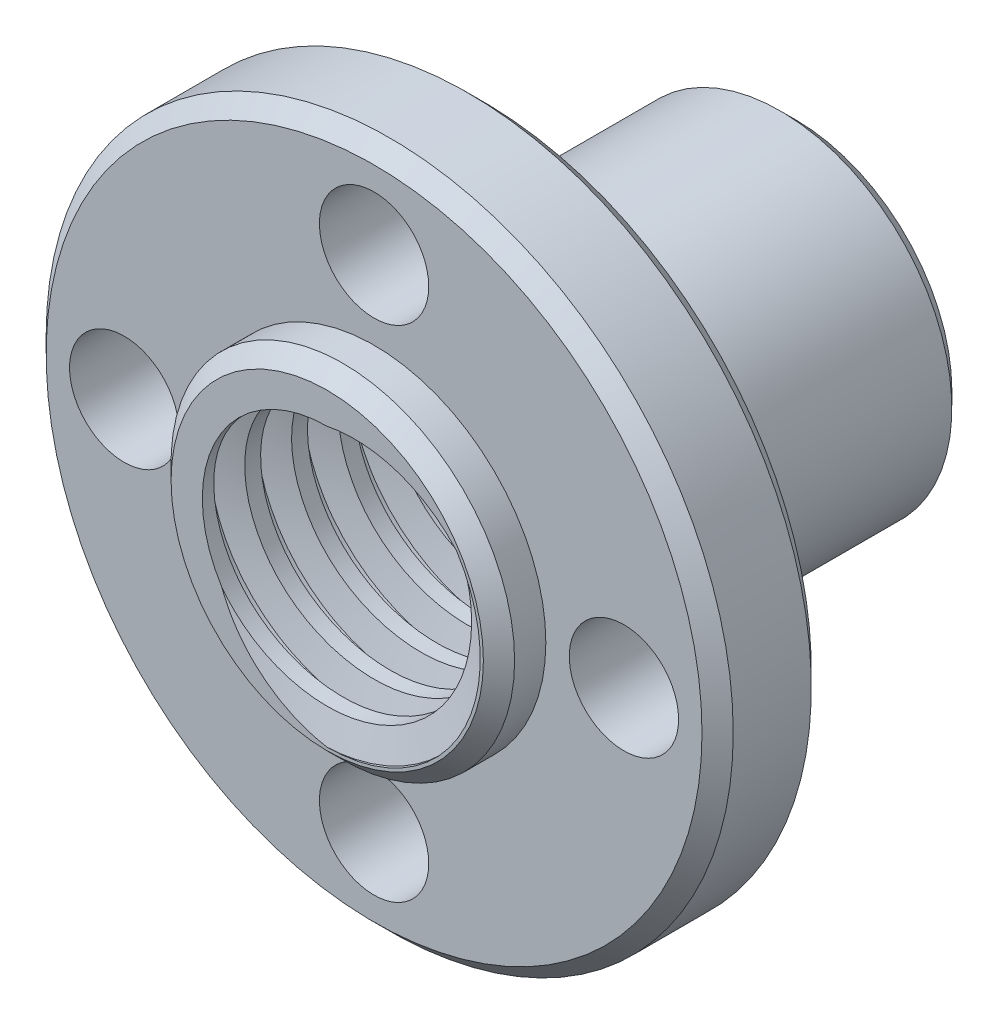
from build123d import *

# Parameters (mm, degrees)
SKETCH_1_W          = 15
SKETCH_1_H          = 7
SWEEP_1_PITCH       = 1.5
CUT_EXTRUDE_START   = -1.5
SKETCH_4_R          = 11
SKETCH_4_R_2        = 5.5
CUT_EXTRUDE_1_DEPTH = 1.5
SKETCH_5_R          = 11
SKETCH_5_R_2        = 5.5
CUT_EXTRUDE_2_DEPTH = 10
SKETCH_6_R          = 1.75
CUT_EXTRUDE_3_DEPTH = 21.59732999
CHAMFER_1_SIZE      = 0.5


with BuildPart() as part:
    # 草图1 → 旋转1 (revolve)
    with BuildSketch(Plane(origin=(0, 0, 0), x_dir=(0, 0, -1), z_dir=(1, 0, 0)), mode=Mode.PRIVATE) as revolve_1_sk:
        with Locations((-7.5, 7.5)):
            Rectangle(SKETCH_1_W, SKETCH_1_H)
    revolve(revolve_1_sk.sketch.rotate(Axis((0, 0, 0), (0, 0, 1)), 90), axis=Axis((0, 0, 0), (0, 0, 1)))

    # 切除-扫描1: the profile of 草图2 profile screwed along a left-hand helix of 20 turns, 6 arcs to a turn; built about Z, then put on its axis
    sweep_1_z = Axis((0, 0, 0), (0, 0, 1))
    sweep_1_corners = [(3.9997, 0, 8.0385e-05), (3.9997, 0, -0.991234658), (4.9, 0, -0.75), (4.9, 0, -0.241154273)]
    with BuildLine(mode=Mode.PRIVATE) as sweep_1_profile:
        Line(sweep_1_corners[0], sweep_1_corners[1])
        Line(sweep_1_corners[1], sweep_1_corners[2])
        Line(sweep_1_corners[2], sweep_1_corners[3])
        Line(sweep_1_corners[3], sweep_1_corners[0])
    sweep_1_cap = Face(sweep_1_profile.wire())
    sweep_1_turn_angles = [0, -30, -60, -90, -120, -150, -180, -210, -240, -270, -300, -330, -360]
    sweep_1_turn_weights = [1, 0.8660254037844387, 1, 0.8660254037844387, 1, 0.8660254037844387, 1, 0.8660254037844387, 1, 0.8660254037844387, 1, 0.8660254037844387, 1]
    sweep_1_turn_rails = [Edge.make_bspline([Vector(p[0], p[1], 0).rotate(sweep_1_z, sweep_1_turn_angles[k]) / sweep_1_turn_weights[k] + Vector(0, 0, p[2] + -SWEEP_1_PITCH * sweep_1_turn_angles[k] / 360) for k in range(13)], [0, 0, 0, 1, 1, 2, 2, 3, 3, 4, 4, 5, 5, 6, 6, 6], 2, sweep_1_turn_weights) for p in sweep_1_corners]
    sweep_1_turn_sides = [Face.make_surface_from_curves(sweep_1_turn_rails[p[0]], sweep_1_turn_rails[p[1]]) for p in [(0, 1), (1, 2), (2, 3), (3, 0)]]
    sweep_1 = Plane(origin=(0, 0, 0), x_dir=(0, 1, 0), z_dir=(0, 0, 1)) * Solid(Shell([*[p.moved(Location((0, 0, SWEEP_1_PITCH * i))) for i in range(20) for p in sweep_1_turn_sides], sweep_1_cap, sweep_1_cap.rotate(sweep_1_z, -7200).moved(Location((0, 0, -SWEEP_1_PITCH * -7200 / 360)))]))
    add(sweep_1, mode=Mode.SUBTRACT)

    # 草图4 → 切除-拉伸1 (cut)
    with BuildSketch(Plane.XY.offset(15).offset(CUT_EXTRUDE_START)):
        with Locations(Location((0, 0, 0), (0, 0, 180))):
            Circle(SKETCH_4_R)
        Circle(SKETCH_4_R_2, mode=Mode.SUBTRACT)
    extrude(amount=CUT_EXTRUDE_1_DEPTH, mode=Mode.SUBTRACT)

    # 草图5 → 切除-拉伸2 (cut)
    with BuildSketch(Plane(origin=(0, 0, 0), x_dir=(-1, 0, 0), z_dir=(0, 0, -1))):
        Circle(SKETCH_5_R)
        with Locations(Location((0, 0, 0), (0, 0, 180))):
            Circle(SKETCH_5_R_2, mode=Mode.SUBTRACT)
    extrude(amount=-CUT_EXTRUDE_2_DEPTH, mode=Mode.SUBTRACT)

    # 草图6 → 切除-拉伸3 (cut, through all)
    with BuildSketch(Plane.XY.offset(13.5)):
        with Locations((0, 8)):
            Circle(SKETCH_6_R)
        with Locations((-8, 0)):
            Circle(SKETCH_6_R)
        with Locations((0, -8)):
            Circle(SKETCH_6_R)
        with Locations((8, 0)):
            Circle(SKETCH_6_R)
    extrude(amount=-CUT_EXTRUDE_3_DEPTH, mode=Mode.SUBTRACT)

    # 倒角1
    chamfer_1_edges = [part.edges().sort_by_distance(p)[0] for p in [
        (11, 0, 13.5),
        (-5.5, 0, 15),
        (11, 0, 10),
        (-5.5, 0, 0),
    ]]
    chamfer(chamfer_1_edges, length=CHAMFER_1_SIZE)


solid = part.part
